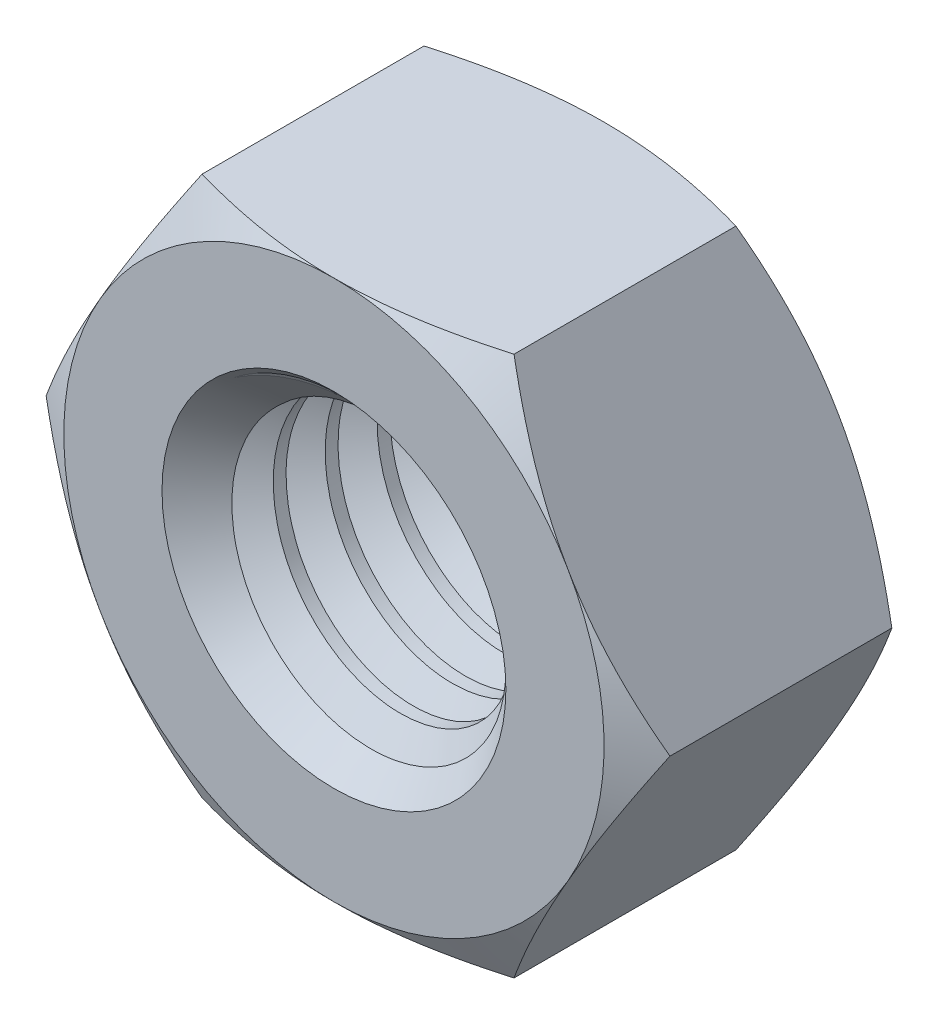
from build123d import *

# Parameters (mm, degrees)
Y_KSEKLIK_EKSTR_ZYON1_DEPTH = 6.5
IZIM2_OUTSIDE_W             = 43.708
IZIM2_OUTSIDE_H             = 41.696
IZIM2_OUTSIDE_R             = 6.5
KES_EKSTR_ZYON1_DEPTH       = 6.5
KES_EKSTR_ZYON1_DRAFT       = -60
IZIM3_OUTSIDE_W             = 43.708
IZIM3_OUTSIDE_H             = 41.696
IZIM3_OUTSIDE_R             = 6.5
KES_EKSTR_ZYON2_DEPTH       = 6.5
KES_EKSTR_ZYON2_DRAFT       = -60
IZIM4_R                     = 3.1875
KES_EKSTR_ZYON3_DEPTH       = 6.5
PAH1_SIZE                   = 0.95
KES_S_P_R1_PITCH            = 1.25


with BuildPart() as part:
    # Çizim1 → Yükseklik-Ekstrüzyon1 (new body)
    with BuildSketch(Plane.XY):
        Polygon((7.505553499, 0), (3.75277675, 6.5), (-3.75277675, 6.5), (-7.505553499, 0), (-3.75277675, -6.5), (3.75277675, -6.5), align=None)
    extrude(amount=Y_KSEKLIK_EKSTR_ZYON1_DEPTH)


with BuildPart() as kes_ekstr_zyon1_tool:
    # Çizim2 outside → Kes-Ekstrüzyon1 (with draft: the straight prism first)
    with BuildSketch(Plane.XY.offset(6.5)):
        Rectangle(IZIM2_OUTSIDE_W, IZIM2_OUTSIDE_H)
        Circle(IZIM2_OUTSIDE_R, mode=Mode.SUBTRACT)
    extrude(amount=-KES_EKSTR_ZYON1_DEPTH)
    # Kes-Ekstrüzyon1: the draft: its side faces are tilted about the plane it starts from
    kes_ekstr_zyon1_sides = [kes_ekstr_zyon1_tool.faces().sort_by_distance(p)[0] for p in [
        (0, -20.848, 3.25),
        (21.854, 0, 3.25),
        (0, 20.848, 3.25),
        (-21.854, 0, 3.25),
        (-6.5, 0, 3.25),
    ]]
    draft(kes_ekstr_zyon1_sides, Plane.XY.offset(6.5), KES_EKSTR_ZYON1_DRAFT)


with BuildPart() as part_1:
    add(part.part)

    # Kes-Ekstrüzyon1: cut by kes_ekstr_zyon1_tool
    add(kes_ekstr_zyon1_tool.part, mode=Mode.SUBTRACT)


with BuildPart() as kes_ekstr_zyon2_tool:
    # Çizim3 outside → Kes-Ekstrüzyon2 (with draft: the straight prism first)
    with BuildSketch(Plane(origin=(0, 0, 0), x_dir=(-1, 0, 0), z_dir=(0, 0, -1))):
        Rectangle(IZIM3_OUTSIDE_W, IZIM3_OUTSIDE_H)
        Circle(IZIM3_OUTSIDE_R, mode=Mode.SUBTRACT)
    extrude(amount=-KES_EKSTR_ZYON2_DEPTH)
    # Kes-Ekstrüzyon2: the draft: its side faces are tilted about the plane it starts from
    kes_ekstr_zyon2_sides = [kes_ekstr_zyon2_tool.faces().sort_by_distance(p)[0] for p in [
        (0, -20.848, 3.25),
        (-21.854, 0, 3.25),
        (0, 20.848, 3.25),
        (21.854, 0, 3.25),
        (6.5, 0, 3.25),
    ]]
    draft(kes_ekstr_zyon2_sides, Plane(origin=(0, 0, 0), x_dir=(-1, 0, 0), z_dir=(0, 0, -1)), KES_EKSTR_ZYON2_DRAFT)


with BuildPart() as part_2:
    add(part_1.part)

    # Kes-Ekstrüzyon2: cut by kes_ekstr_zyon2_tool
    add(kes_ekstr_zyon2_tool.part, mode=Mode.SUBTRACT)

    # Çizim4 → Kes-Ekstrüzyon3 (cut)
    with BuildSketch(Plane(origin=(0, 0, 0), x_dir=(-1, 0, 0), z_dir=(0, 0, -1))):
        Circle(IZIM4_R)
    extrude(amount=-KES_EKSTR_ZYON3_DEPTH, mode=Mode.SUBTRACT)

    # Pah1
    pah1_edges = [part_2.edges().sort_by_distance(p)[0] for p in [
        (3.1875, 0, 6.5),
        (3.1875, 0, 0),
    ]]
    chamfer(pah1_edges, length=PAH1_SIZE)

    # Kes-Süpür1: arcs per turn and ends read off the stored shape
    # Kes-Süpür1: the profile of Çizim6 screwed along a right-hand helix through 6.4 turns, 8 arcs to a turn; built about Z, then put on its axis
    kes_s_p_r1_z = Axis((0, 0, 0), (0, 0, 1))
    kes_s_p_r1_corners = [(2.934833156, -0.040098287, 0.64245966), (2.877718997, 0.03851261, -0.61705375), (3.999169154, 0.002288292, -0.036663299)]
    with BuildLine(mode=Mode.PRIVATE) as kes_s_p_r1_profile:
        Line(kes_s_p_r1_corners[0], kes_s_p_r1_corners[1])
        Line(kes_s_p_r1_corners[1], kes_s_p_r1_corners[2])
        Line(kes_s_p_r1_corners[2], kes_s_p_r1_corners[0])
    kes_s_p_r1_cap = Face(kes_s_p_r1_profile.wire())
    kes_s_p_r1_turn_angles = [0, 22.5, 45, 67.5, 90, 112.5, 135, 157.5, 180, 202.5, 225, 247.5, 270, 292.5, 315, 337.5, 360]
    kes_s_p_r1_turn_weights = [1, 0.9238795325112867, 1, 0.9238795325112867, 1, 0.9238795325112867, 1, 0.9238795325112867, 1, 0.9238795325112867, 1, 0.9238795325112867, 1, 0.9238795325112867, 1, 0.9238795325112867, 1]
    kes_s_p_r1_turn_rails = [Edge.make_bspline([Vector(p[0], p[1], 0).rotate(kes_s_p_r1_z, kes_s_p_r1_turn_angles[k]) / kes_s_p_r1_turn_weights[k] + Vector(0, 0, p[2] + KES_S_P_R1_PITCH * kes_s_p_r1_turn_angles[k] / 360) for k in range(17)], [0, 0, 0, 1, 1, 2, 2, 3, 3, 4, 4, 5, 5, 6, 6, 7, 7, 8, 8, 8], 2, kes_s_p_r1_turn_weights) for p in kes_s_p_r1_corners]
    kes_s_p_r1_turn_sides = [Face.make_surface_from_curves(kes_s_p_r1_turn_rails[p[0]], kes_s_p_r1_turn_rails[p[1]]) for p in [(0, 1), (1, 2), (2, 0)]]
    kes_s_p_r1_last_angles = [2160, 2182.5, 2205, 2227.5, 2250, 2272.5, 2295, 2299.5, 2304]
    kes_s_p_r1_last_weights = [1, 0.9238795325112867, 1, 0.9238795325112867, 1, 0.9238795325112867, 1, 0.9969173337331257, 1]
    kes_s_p_r1_last_rails = [Edge.make_bspline([Vector(p[0], p[1], 0).rotate(kes_s_p_r1_z, kes_s_p_r1_last_angles[k]) / kes_s_p_r1_last_weights[k] + Vector(0, 0, p[2] + KES_S_P_R1_PITCH * kes_s_p_r1_last_angles[k] / 360) for k in range(9)], [0, 0, 0, 1, 1, 2, 2, 3, 3, 4, 4, 4], 2, kes_s_p_r1_last_weights) for p in kes_s_p_r1_corners]
    kes_s_p_r1_last_sides = [Face.make_surface_from_curves(kes_s_p_r1_last_rails[p[0]], kes_s_p_r1_last_rails[p[1]]) for p in [(0, 1), (1, 2), (2, 0)]]
    kes_s_p_r1 = Plane(origin=(0, 0, 6.5), x_dir=(-1, 0, 0), z_dir=(0, 0, -1)) * Solid(Shell([*[p.moved(Location((0, 0, KES_S_P_R1_PITCH * i))) for i in range(6) for p in kes_s_p_r1_turn_sides], *kes_s_p_r1_last_sides, kes_s_p_r1_cap, kes_s_p_r1_cap.rotate(kes_s_p_r1_z, 2304).moved(Location((0, 0, KES_S_P_R1_PITCH * 2304 / 360)))]))
    add(kes_s_p_r1, mode=Mode.SUBTRACT)


solid = part_2.part
